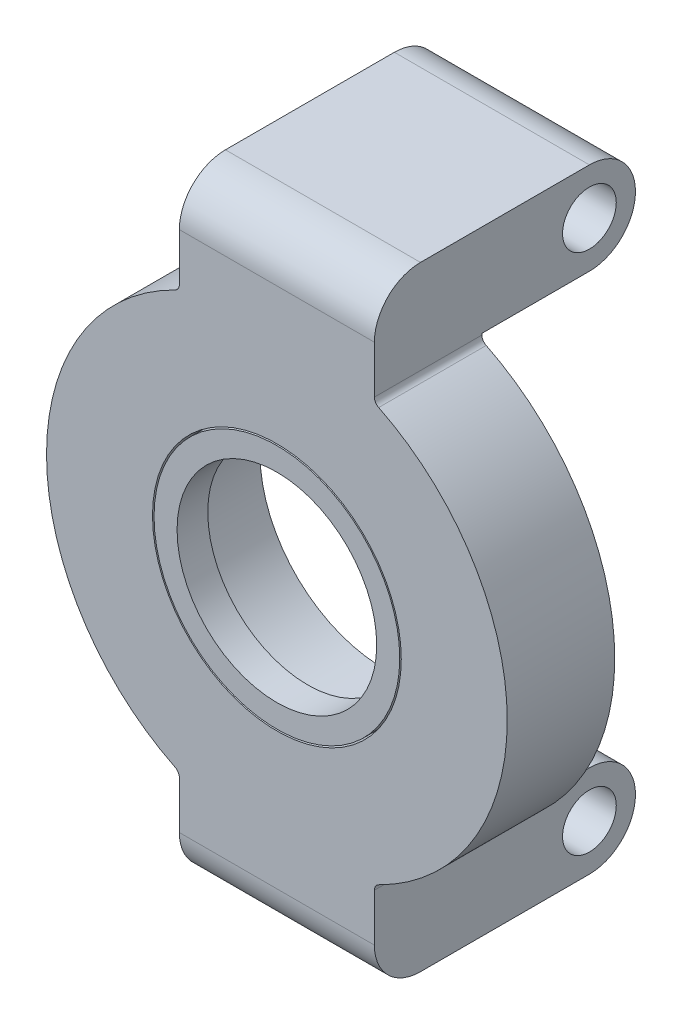
from build123d import *

# Parameters (mm, degrees)
CROQUIS1_R              = 8.1
SALIENTE_EXTRUIR4_DEPTH = 7
CROQUIS5_W              = 12.7
CROQUIS5_H              = 6
SALIENTE_EXTRUIR5_DEPTH = 10
REDONDEO1_R             = 3
CROQUIS7_R              = 1.75
CORTAR_EXTRUIR1_DEPTH   = 31.916379154
CROQUIS8_R              = 8
CROQUIS8_R_2            = 6.5
SALIENTE_EXTRUIR6_DEPTH = 2
REDONDEO3_R             = 3
REDONDEO4_R             = 0.5


with BuildPart() as part:
    # Croquis1 → Saliente-Extruir4 (new body)
    with BuildSketch(Plane.XY):
        with BuildLine():
            Line((-6.35, -20), (6.35, -20))
            Line((6.35, -20), (6.35, -13.589610002))
            ThreePointArc((6.35, -13.589610002), (15, 0), (6.35, 13.589610002))
            Line((6.35, 13.589610002), (6.35, 20))
            Line((6.35, 20), (-6.35, 20))
            Line((-6.35, 20), (-6.35, 13.589610002))
            ThreePointArc((-6.35, 13.589610002), (-15, 0), (-6.35, -13.589610002))
            Line((-6.35, -13.589610002), (-6.35, -20))
        make_face()
        Circle(CROQUIS1_R, mode=Mode.SUBTRACT)
    extrude(amount=SALIENTE_EXTRUIR4_DEPTH)

    # Croquis5 → Saliente-Extruir5 (add)
    with BuildSketch(Plane(origin=(0, 0, 0), x_dir=(-1, 0, 0), z_dir=(0, 0, -1))):
        with Locations((0, 17)):
            Rectangle(CROQUIS5_W, CROQUIS5_H)
        with Locations((0, -17)):
            Rectangle(CROQUIS5_W, CROQUIS5_H)
    extrude(amount=SALIENTE_EXTRUIR5_DEPTH)

    # Redondeo1
    redondeo1_edges = [part.edges().sort_by_distance(p)[0] for p in [
        (0, 14, -10),
        (0, 20, -10),
        (0, -14, -10),
        (0, -20, -10),
    ]]
    fillet(redondeo1_edges, radius=REDONDEO1_R - 0.0001)  # a hair under: the kernel refuses the full size

    # Croquis7 → Cortar-Extruir1 (cut, through all)
    with BuildSketch(Plane(origin=(6.35, 0, 0), x_dir=(0, 0, -1), z_dir=(1, 0, 0))):
        with Locations((7, 17)):
            Circle(CROQUIS7_R)
        with Locations((7, -17)):
            Circle(CROQUIS7_R)
    extrude(amount=-CORTAR_EXTRUIR1_DEPTH, mode=Mode.SUBTRACT)

    # Redondeo3
    redondeo3_edges = [part.edges().sort_by_distance(p)[0] for p in [
        (0, -20, 7),
        (0, 20, 7),
    ]]
    fillet(redondeo3_edges, radius=REDONDEO3_R)

    # Redondeo4
    redondeo4_edges = [part.edges().sort_by_distance(p)[0] for p in [
        (6.35, 13.589610002, 3.5),
        (6.35, -13.589610002, 3.5),
        (-6.35, -13.589610002, 3.5),
        (-6.35, 13.589610002, 3.5),
    ]]
    fillet(redondeo4_edges, radius=REDONDEO4_R)


with BuildPart() as body_2:
    # Croquis8 → Saliente-Extruir6 (new body)
    with BuildSketch(Plane.XY.offset(7)):
        Circle(CROQUIS8_R)
        Circle(CROQUIS8_R_2, mode=Mode.SUBTRACT)
    extrude(amount=-SALIENTE_EXTRUIR6_DEPTH)


solid = Compound([part.part, body_2.part])
